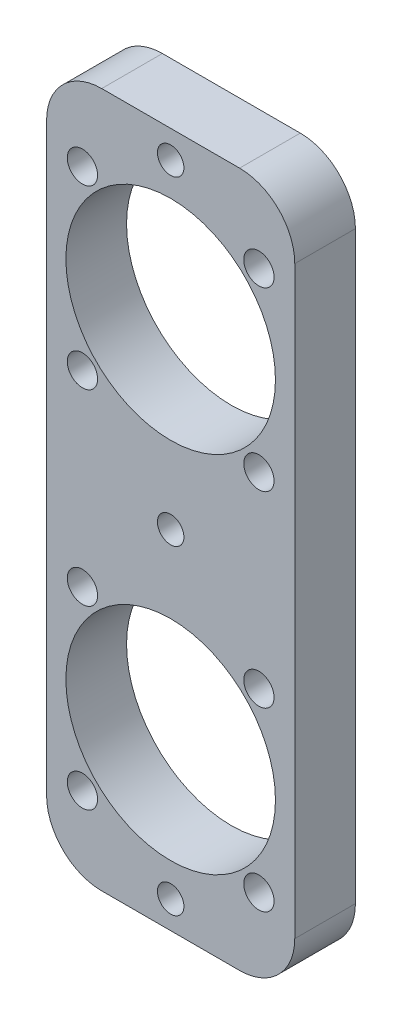
from build123d import *

# Parameters (mm, degrees)
SKETCH1_W            = 45
SKETCH1_H            = 60
BOSS_EXTRUDE1_DEPTH  = 11
SKETCH6_R            = 2.75
CUT_EXTRUDE2_DEPTH   = 8.5
CUT_EXTRUDE3_DEPTH   = 40.080046059
SKETCH11_W           = 45
SKETCH11_H           = 11
BOSS_EXTRUDE2_DEPTH  = 6
M4_CLEARANCE_HOLE2_D = 4.8
FILLET1_R            = 10


with BuildPart() as part:
    # Sketch1 → Boss-Extrude1 (new body)
    with BuildSketch(Plane.XY):
        Rectangle(SKETCH1_W, SKETCH1_H)
    boss_extrude1 = extrude(amount=-BOSS_EXTRUDE1_DEPTH)

    # Sketch6 → Cut-Extrude2 (cut)
    with BuildSketch(Plane.XY):
        with Locations((-16, 16)):
            Circle(SKETCH6_R)
        with Locations((16, 16)):
            Circle(SKETCH6_R)
        with Locations((16, -16)):
            Circle(SKETCH6_R)
        with Locations((-16, -16)):
            Circle(SKETCH6_R)
    cut_extrude2 = extrude(amount=-CUT_EXTRUDE2_DEPTH, mode=Mode.SUBTRACT)

    # Sketch7 → Cut-Extrude3 (cut, through all)
    with BuildSketch(Plane.XY):
        with BuildLine():
            ThreePointArc((19, 0), (0, 19), (-19, 0))
            ThreePointArc((-19, 0), (0, -19), (19, 0))
        make_face()
    cut_extrude3 = extrude(amount=-CUT_EXTRUDE3_DEPTH, mode=Mode.SUBTRACT)

    # Sketch11 → Boss-Extrude2 (add)
    with BuildSketch(Plane.XZ.offset(30)):
        with Locations((0, -5.5)):
            Rectangle(SKETCH11_W, SKETCH11_H)
    extrude(amount=BOSS_EXTRUDE2_DEPTH)

    # Mirror1: Boss-Extrude1, Cut-Extrude2, Cut-Extrude3 across plane
    add(boss_extrude1.mirror(Plane(origin=(0, -33, 0), x_dir=(0, 0, 1), z_dir=(0, -1, 0))))
    add(cut_extrude2.mirror(Plane(origin=(0, -33, 0), x_dir=(0, 0, 1), z_dir=(0, -1, 0))), mode=Mode.SUBTRACT)
    add(cut_extrude3.mirror(Plane(origin=(0, -33, 0), x_dir=(0, 0, 1), z_dir=(0, -1, 0))), mode=Mode.SUBTRACT)

    # M4 Clearance Hole2 (through all)
    with Locations(Plane.XY):
        with Locations((0, -91), (0, -33), (0, 25)):
            Hole(M4_CLEARANCE_HOLE2_D / 2)

    # Fillet1
    fillet1_edges = [part.edges().sort_by_distance(p)[0] for p in [
        (-22.5, -96, -5.5),
        (22.5, -96, -5.5),
        (22.5, 30, -5.5),
        (-22.5, 30, -5.5),
    ]]
    fillet(fillet1_edges, radius=FILLET1_R)


solid = part.part
